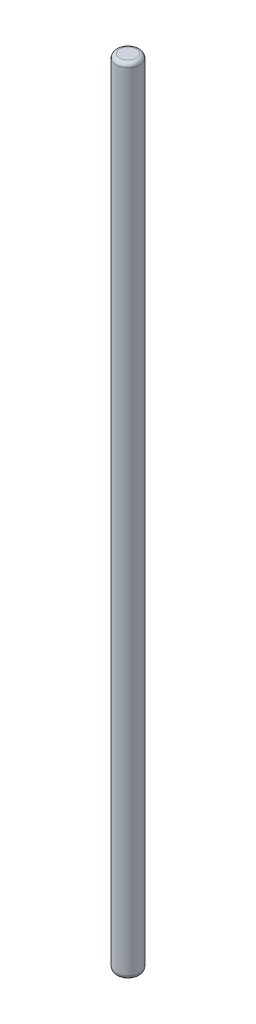
from build123d import *

# Parameters (mm, degrees)
SKETCH1_R           = 2.38125
BOSS_EXTRUDE1_DEPTH = 158.75
FILLET1_R           = 0.762


with BuildPart() as part:
    # Sketch1 → Boss-Extrude1 (new body)
    with BuildSketch(Plane(origin=(0, 0, 0), x_dir=(1, 0, 0), z_dir=(0, 1, 0))):
        Circle(SKETCH1_R)
    extrude(amount=BOSS_EXTRUDE1_DEPTH)

    # Fillet1
    fillet1_edges = [part.edges().sort_by_distance(p)[0] for p in [
        (-2.38125, 0, 0),
        (-2.38125, 158.75, 0),
    ]]
    fillet(fillet1_edges, radius=FILLET1_R)


solid = part.part
